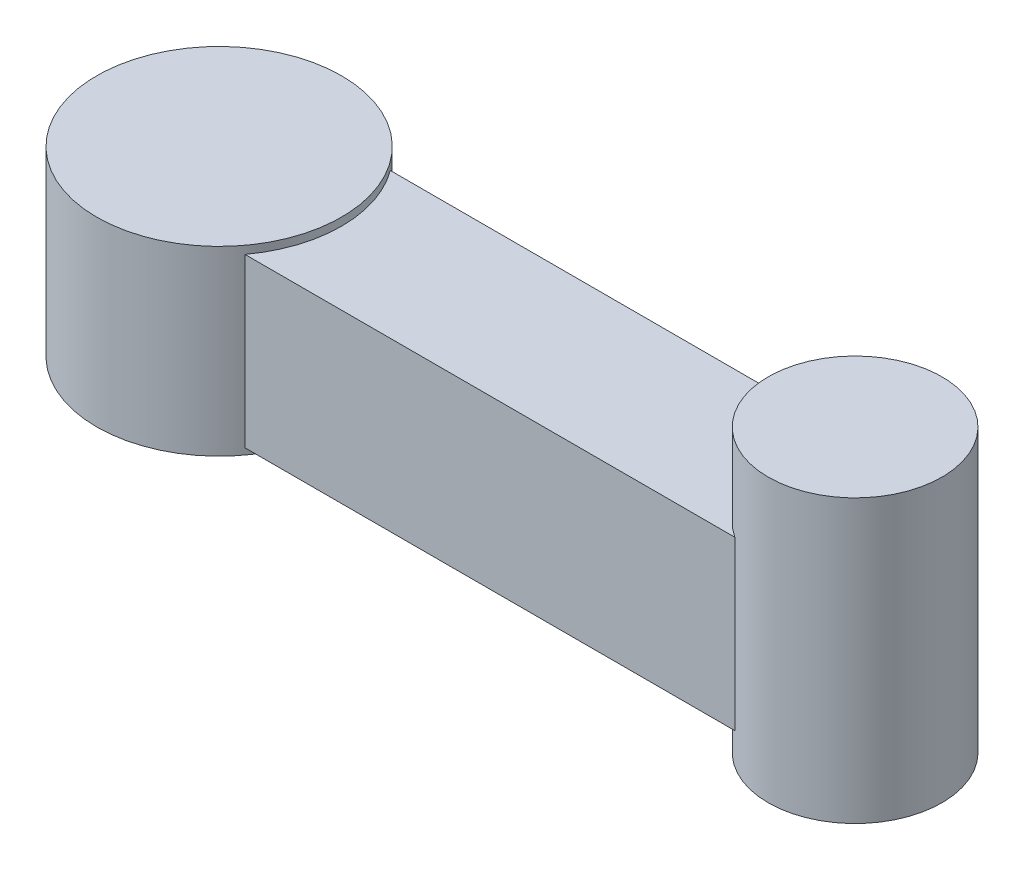
from build123d import *
from build123d.topology import SkipClean

# Parameters (mm, degrees)
SALIENTE_EXTRUIR1_DEPTH      = 106
SALIENTE_EXTRUIR2_DEPTH      = 5
SALIENTE_EXTRUIR2_DEPTH_BACK = 110
CROQUIS2_R                   = 77.5
SALIENTE_EXTRUIR3_DEPTH      = 52.5
SALIENTE_EXTRUIR3_DEPTH_BACK = 126
CROQUIS3_R                   = 55


with BuildPart() as part:
    # Croquis1 → Saliente-Extruir1 (new body)
    with BuildSketch(Plane(origin=(0, 0, 0), x_dir=(1, 0, 0), z_dir=(0, 1, 0))):
        with BuildLine():
            Line((62.371868659, 46), (372.350129794, 46))
            ThreePointArc((372.350129794, 46), (457.499756657, 0), (372.350129794, -46))
            Line((372.350129794, -46), (62.371868659, -46))
            ThreePointArc((62.371868659, -46), (-77.5, 0), (62.371868659, 46))
        make_face()
    extrude(amount=SALIENTE_EXTRUIR1_DEPTH)

    # Croquis2 → Saliente-Extruir2 (add, two sides: drawn at the far end of the back side and taken through both)
    with SkipClean():  # the faces are left unmerged after this step: merging them gives an invalid solid
        with BuildSketch(Plane(origin=(0, 106, 0), x_dir=(1, 0, 0), z_dir=(0, 1, 0)).offset(-SALIENTE_EXTRUIR2_DEPTH_BACK)):
            Circle(CROQUIS2_R)
        extrude(amount=SALIENTE_EXTRUIR2_DEPTH + SALIENTE_EXTRUIR2_DEPTH_BACK)
    add(part.part.scale(1), mode=Mode.REPLACE)  # the faces are merged on a copy

    # Croquis3 → Saliente-Extruir3 (add, two sides: drawn at the far end of the back side and taken through both)
    with SkipClean():  # the faces are left unmerged after this step: merging them gives an invalid solid
        with BuildSketch(Plane(origin=(0, 106, 0), x_dir=(1, 0, 0), z_dir=(0, 1, 0)).offset(-SALIENTE_EXTRUIR3_DEPTH_BACK)):
            with Locations((402.499756657, 0)):
                Circle(CROQUIS3_R)
        extrude(amount=SALIENTE_EXTRUIR3_DEPTH + SALIENTE_EXTRUIR3_DEPTH_BACK)
    add(part.part.scale(1), mode=Mode.REPLACE)  # the faces are merged on a copy


solid = part.part
